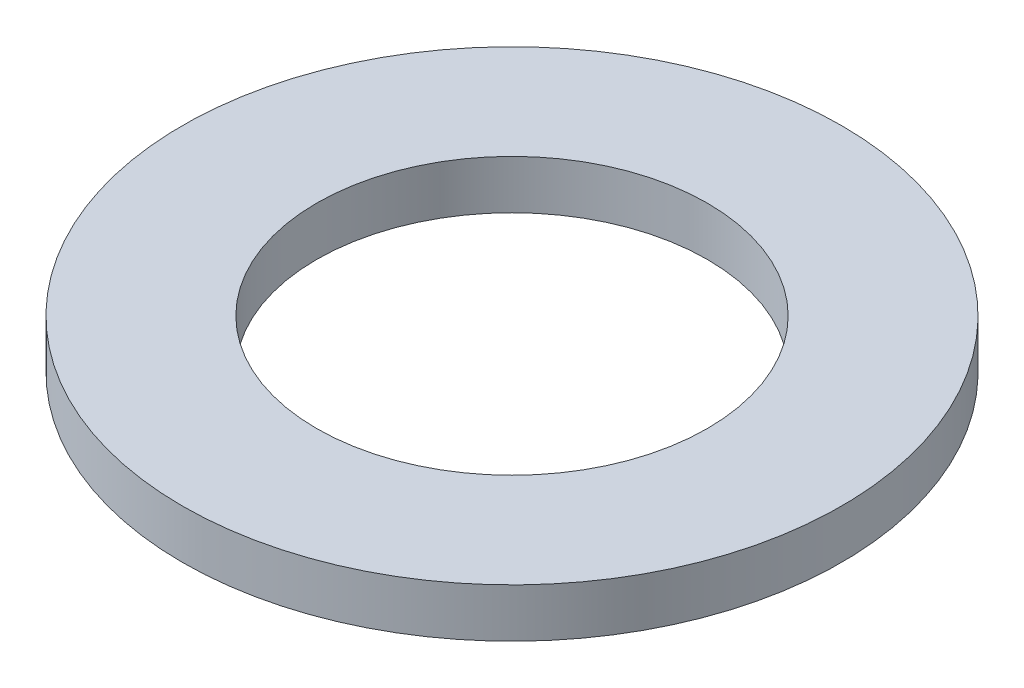
from build123d import *

# Parameters (mm, degrees)
SKETCH1_R           = 67.5
BOSS_EXTRUDE1_DEPTH = 10
SKETCH2_R           = 40
CUT_EXTRUDE1_DEPTH  = 96.981769102


with BuildPart() as part:
    # Sketch1 → Boss-Extrude1 (new body)
    with BuildSketch(Plane(origin=(0, 0, 0), x_dir=(1, 0, 0), z_dir=(0, 1, 0))):
        Circle(SKETCH1_R)
    extrude(amount=BOSS_EXTRUDE1_DEPTH)

    # Sketch2 → Cut-Extrude1 (cut, through all)
    with BuildSketch(Plane(origin=(0, 0, 0), x_dir=(1, 0, 0), z_dir=(0, 1, 0))):
        Circle(SKETCH2_R)
    extrude(amount=CUT_EXTRUDE1_DEPTH, mode=Mode.SUBTRACT)


solid = part.part
